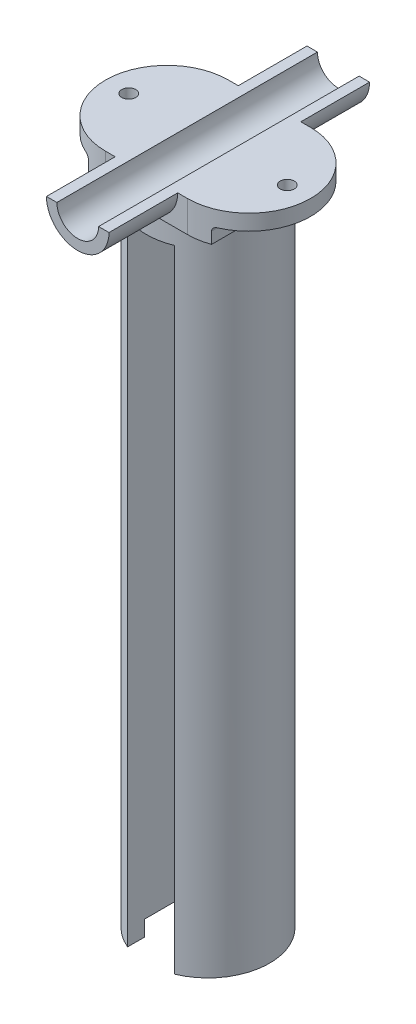
from build123d import *

# Parameters (mm, degrees)
BOSS_EXTRUDE1_DEPTH   = 150
BOSS_EXTRUDE1_2_DEPTH = 150
SKETCH2_R             = 15
BOSS_EXTRUDE2_DEPTH   = 5
SKETCH3_W             = 30
SKETCH3_H             = 63.5
BOSS_EXTRUDE3_DEPTH   = 15.24
SKETCH4_R             = 5.08
CUT_EXTRUDE1_DEPTH    = 183.315406919
CUT_EXTRUDE3_START    = -16.75
CUT_EXTRUDE3_DEPTH    = 16.75
CUT_EXTRUDE4_START    = -16.75
CUT_EXTRUDE4_DEPTH    = 16.75
SKETCH7_W             = 63.5
SKETCH7_H             = 7.62
CUT_EXTRUDE5_DEPTH    = 176.754715726
SKETCH8_W             = 30
SKETCH8_H             = 3.81
BOSS_EXTRUDE4_DEPTH   = 10
CUT_EXTRUDE6_START    = -7.62
CUT_EXTRUDE6_DEPTH    = 7.62
SKETCH1_4_R           = 1.25
CUT_EXTRUDE7_DEPTH    = 10
BOSS_EXTRUDE5_START   = 3.8
BOSS_EXTRUDE5_DEPTH   = 3.8
FILLET1_R             = 1
CUT_EXTRUDE8_REACH    = 173.256
SKETCH9_R             = 1.7


# Read off the part's stored shape, not the designer's step: Cut-Extrude6
with BuildPart() as part:
    # Sketch1 → Boss-Extrude1 (new body)
    with BuildSketch(Plane(origin=(0, 0, 0), x_dir=(1, 0, 0), z_dir=(0, 1, 0))):
        with BuildLine():
            Line((-5.75, 13.854151002), (-5.75, -13.854151002))
            ThreePointArc((-5.75, -13.854151002), (-15, 0), (-5.75, 13.854151002))
        make_face()
    extrude(amount=BOSS_EXTRUDE1_DEPTH)



with BuildPart() as body_2:
    # Sketch1 → Boss-Extrude1 2 (new body)
    with BuildSketch(Plane(origin=(0, 0, 0), x_dir=(1, 0, 0), z_dir=(0, 1, 0))):
        with BuildLine():
            Line((5.75, 13.854151002), (5.75, -13.854151002))
            ThreePointArc((5.75, -13.854151002), (15, 0), (5.75, 13.854151002))
        make_face()
    extrude(amount=BOSS_EXTRUDE1_2_DEPTH)


with BuildPart() as part_1:
    add(part.part)

    add(body_2.part)  # Boss-Extrude2 merges body 2
    # Sketch2 → Boss-Extrude2 (add)
    with BuildSketch(Plane(origin=(0, 150, 0), x_dir=(1, 0, 0), z_dir=(0, 1, 0))):
        with Locations(Location((0, 0, 0), (0, 0, 112.540310464))):
            Circle(SKETCH2_R)
    extrude(amount=BOSS_EXTRUDE2_DEPTH)

    # Sketch3 → Boss-Extrude3 (add)
    with BuildSketch(Plane(origin=(0, 155, 0), x_dir=(1, 0, 0), z_dir=(0, 1, 0))):
        Rectangle(SKETCH3_W, SKETCH3_H)
    extrude(amount=BOSS_EXTRUDE3_DEPTH)

    # Sketch4 → Cut-Extrude1 (cut, through all)
    with BuildSketch(Plane.XY.offset(31.75)):
        with Locations((0, 162.62)):
            Circle(SKETCH4_R)
    extrude(amount=-CUT_EXTRUDE1_DEPTH, mode=Mode.SUBTRACT)

    # Sketch6 → Cut-Extrude3 (cut)
    with BuildSketch(Plane(origin=(0, 0, -31.75), x_dir=(-1, 0, 0), z_dir=(0, 0, -1)).offset(CUT_EXTRUDE3_START)):
        with BuildLine():
            ThreePointArc((-9.9e-08, 170.24), (7.62, 162.62000005), (0, 155))
            Line((0, 155), (15, 155))
            Line((15, 155), (15, 170.24))
            Line((15, 170.24), (-9.9e-08, 170.24))
        make_face()
        with BuildLine():
            ThreePointArc((0, 155), (-7.62, 162.61999995), (-9.9e-08, 170.24))
            Line((-9.9e-08, 170.24), (-15, 170.24))
            Line((-15, 170.24), (-15, 155))
            Line((-15, 155), (0, 155))
        make_face()
    extrude(amount=CUT_EXTRUDE3_DEPTH, mode=Mode.SUBTRACT)

    # Sketch4<4> → Cut-Extrude4 (cut)
    with BuildSketch(Plane.XY.offset(31.75).offset(CUT_EXTRUDE4_START)):
        with BuildLine():
            ThreePointArc((-9.9e-08, 170.24), (7.62, 162.62000005), (0, 155))
            Line((0, 155), (15, 155))
            Line((15, 155), (15, 170.24))
            Line((15, 170.24), (-9.9e-08, 170.24))
        make_face()
        with BuildLine():
            ThreePointArc((0, 155), (-7.62, 162.61999995), (-9.9e-08, 170.24))
            Line((-9.9e-08, 170.24), (-15, 170.24))
            Line((-15, 170.24), (-15, 155))
            Line((-15, 155), (0, 155))
        make_face()
    extrude(amount=CUT_EXTRUDE4_DEPTH, mode=Mode.SUBTRACT)

    # Sketch7 → Cut-Extrude5 (cut, through all)
    with BuildSketch(Plane.ZY.offset(15)):
        with Locations((0, 166.43)):
            Rectangle(SKETCH7_W, SKETCH7_H)
    extrude(amount=-CUT_EXTRUDE5_DEPTH, mode=Mode.SUBTRACT)

    # Sketch8 → Boss-Extrude4 (add)
    with BuildSketch(Plane.ZY.offset(15)):
        with Locations((0, 160.715)):
            Rectangle(SKETCH8_W, SKETCH8_H)
    boss_extrude4 = extrude(amount=BOSS_EXTRUDE4_DEPTH)

    # Mirror2: Boss-Extrude4 across plane
    add(boss_extrude4.mirror(Plane(origin=(0, 0, 0), x_dir=(0, 0, 1), z_dir=(1, 0, 0))))

    # Cut-Extrude6 outline → Cut-Extrude6 (cut)
    with BuildSketch(Plane(origin=(0, 162.62, 0), x_dir=(1, 0, 0), z_dir=(0, 1, 0)).offset(CUT_EXTRUDE6_START)):
        with BuildLine():
            Line((25, 15), (10, 15))
            ThreePointArc((10, 15), (20.606601718, 10.606601718), (25, 0))
            Line((25, 0), (25, 15))
        make_face()
        with BuildLine():
            Line((25, -15), (25, 0))
            ThreePointArc((25, 0), (20.606601718, -10.606601718), (10, -15))
            Line((10, -15), (25, -15))
        make_face()
    cut_extrude6 = extrude(amount=CUT_EXTRUDE6_DEPTH, mode=Mode.SUBTRACT)

    # Mirror3: Cut-Extrude6 across plane
    add(cut_extrude6.mirror(Plane(origin=(0, 0, 0), x_dir=(0, 0, 1), z_dir=(1, 0, 0))), mode=Mode.SUBTRACT)

    # Sketch1<4> → Cut-Extrude7 (cut)
    with BuildSketch(Plane(origin=(0, 0, 0), x_dir=(1, 0, 0), z_dir=(0, 1, 0))):
        with Locations(Location((-8, 0, 0), (0, 0, 270))):
            Circle(SKETCH1_4_R)
        with Locations(Location((8, 0, 0), (0, 0, 270))):
            Circle(SKETCH1_4_R)
    extrude(amount=CUT_EXTRUDE7_DEPTH, mode=Mode.SUBTRACT)

    # Sketch12 → Boss-Extrude5 (add)
    with BuildSketch(Plane.XZ.offset(BOSS_EXTRUDE5_START)):
        with BuildLine():
            Line((-5.75, 9.669539803), (-5.75, 13.854151002))
            ThreePointArc((-5.75, 13.854151002), (-15, 0), (-5.75, -13.854151002))
            Line((-5.75, -13.854151002), (-5.75, -9.669539803))
            ThreePointArc((-5.75, -9.669539803), (-11.25, 0), (-5.75, 9.669539803))
        make_face()
        with BuildLine():
            ThreePointArc((5.75, -13.854151002), (15, 0), (5.75, 13.854151002))
            Line((5.75, 13.854151002), (5.75, 9.669539803))
            ThreePointArc((5.75, 9.669539803), (11.25, 0), (5.75, -9.669539803))
            Line((5.75, -9.669539803), (5.75, -13.854151002))
        make_face()
    extrude(amount=-BOSS_EXTRUDE5_DEPTH)

    # Fillet1
    fillet1_edges = [part_1.edges().sort_by_distance(p)[0] for p in [
        (15, 158.81, 0),
        (-15, 158.81, 0),
    ]]
    fillet(fillet1_edges, radius=FILLET1_R)

    # Sketch9 → Cut-Extrude8 (cut, up to next)
    with BuildSketch(Plane(origin=(0, 162.62, 0), x_dir=(1, 0, 0), z_dir=(0, 1, 0)), mode=Mode.PRIVATE) as cut_extrude8_sk1:
        with Locations(Location((-19.31, 0, 0), (0, 0, 270))):
            Circle(SKETCH9_R)
    cut_extrude8_tool1 = extrude(cut_extrude8_sk1.sketch, amount=-CUT_EXTRUDE8_REACH, mode=Mode.PRIVATE) & part_1.part
    # Sketch9 → Cut-Extrude8 (cut, up to next)
    with BuildSketch(Plane(origin=(0, 162.62, 0), x_dir=(1, 0, 0), z_dir=(0, 1, 0)), mode=Mode.PRIVATE) as cut_extrude8_sk2:
        with Locations(Location((19.31, 0, 0), (0, 0, 270))):
            Circle(SKETCH9_R)
    cut_extrude8_tool2 = extrude(cut_extrude8_sk2.sketch, amount=-CUT_EXTRUDE8_REACH, mode=Mode.PRIVATE) & part_1.part
    add(cut_extrude8_tool1.solids().sort_by_distance((-19.31, 162.62, 0))[0], mode=Mode.SUBTRACT)
    add(cut_extrude8_tool2.solids().sort_by_distance((19.31, 162.62, 0))[0], mode=Mode.SUBTRACT)


solid = part_1.part
